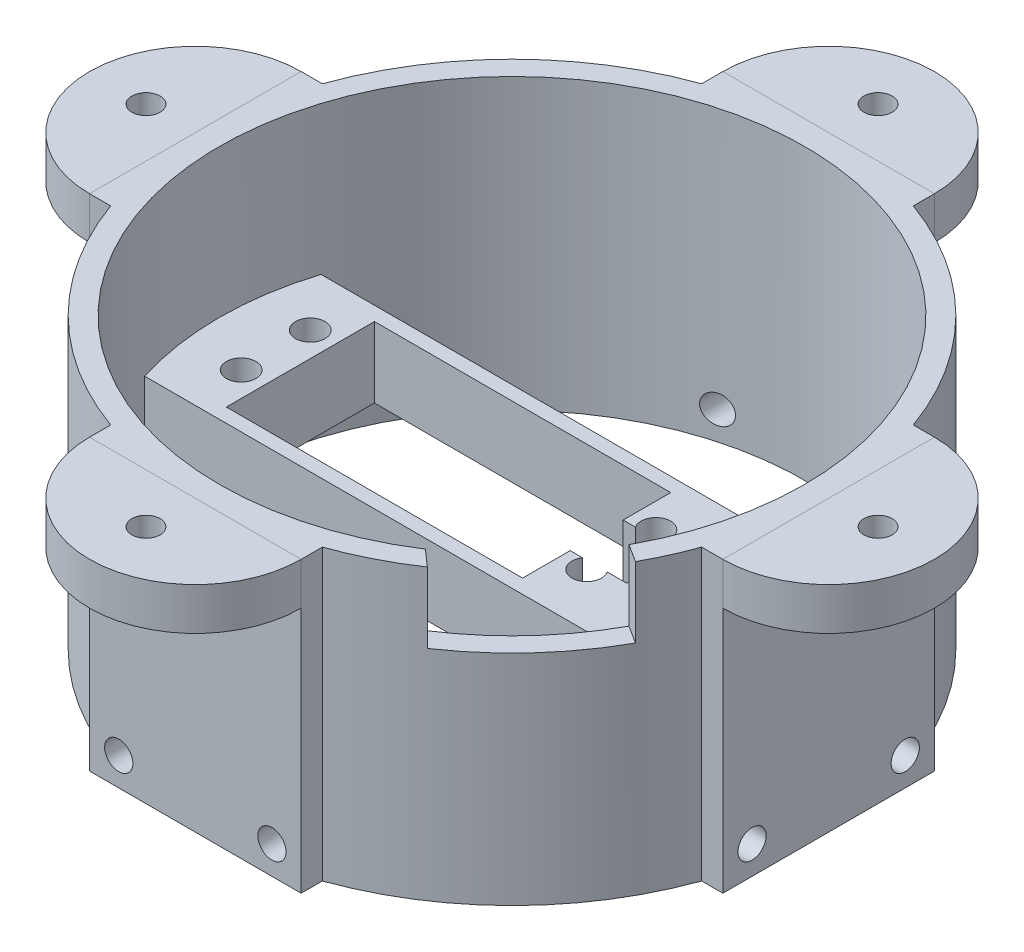
from build123d import *
from build123d.topology import SkipClean

# Parameters (mm, degrees)
SKETCH1_R             = 44.5
SKETCH1_R_2           = 41.5
BOSS_EXTRUDE1_DEPTH   = 41
SKETCH2_R             = 2.1
SKETCH2_W             = 42
SKETCH2_H             = 21
BOSS_EXTRUDE2_DEPTH   = 20
BOSS_EXTRUDE3_DEPTH   = 41
CIRPATTERN1_COUNT     = 4
SKETCH4_R             = 2
CUT_EXTRUDE1_DEPTH    = 7
CUT_EXTRUDE2_DEPTH    = 10
CIRPATTERN2_COUNT     = 4
SKETCH6_R             = 2
BOSS_EXTRUDE4_DEPTH   = 6
BOSS_EXTRUDE4_2_DEPTH = 6
BOSS_EXTRUDE4_3_DEPTH = 6
BOSS_EXTRUDE4_4_DEPTH = 6
SKETCH8_W             = 8
SKETCH8_H             = 7.5
CUT_EXTRUDE3_DEPTH    = 60
CUT_EXTRUDE4_START    = -10
CUT_EXTRUDE4_DEPTH    = 10


with BuildPart() as part:
    # Sketch1 → Boss-Extrude1 (new body)
    with BuildSketch(Plane(origin=(0, 0, 0), x_dir=(1, 0, 0), z_dir=(0, 1, 0))):
        Circle(SKETCH1_R)
        Circle(SKETCH1_R_2, mode=Mode.SUBTRACT)
    extrude(amount=BOSS_EXTRUDE1_DEPTH)

    # Sketch2 → Boss-Extrude2 (add)
    with BuildSketch(Plane(origin=(0, 0, 0), x_dir=(1, 0, 0), z_dir=(0, 1, 0))):
        with BuildLine():
            Line((-39.572717875, 12.5), (39.572717875, 12.5))
            ThreePointArc((39.572717875, 12.5), (41.658434963, 0), (39.572717875, -12.5))
            Line((39.572717875, -12.5), (-39.572717875, -12.5))
            ThreePointArc((-39.572717875, -12.5), (-41.658434963, 0), (-39.572717875, 12.5))
        make_face()
        with Locations((15.5, 4.9)):
            Circle(SKETCH2_R, mode=Mode.SUBTRACT)
        with Locations((15.5, -4.9)):
            Circle(SKETCH2_R, mode=Mode.SUBTRACT)
        with Locations((-33.5, 4.9)):
            Circle(SKETCH2_R, mode=Mode.SUBTRACT)
        with Locations((-33.5, -4.9)):
            Circle(SKETCH2_R, mode=Mode.SUBTRACT)
        with Locations((-9, 0)):
            Rectangle(SKETCH2_W, SKETCH2_H, mode=Mode.SUBTRACT)
    extrude(amount=BOSS_EXTRUDE2_DEPTH)

    # Sketch3 → Boss-Extrude3 (add)
    with BuildSketch(Plane(origin=(0, 0, 0), x_dir=(1, 0, 0), z_dir=(0, 1, 0))):
        with BuildLine():
            Line((0, 44.895703837), (-15, 44.895703837))
            Line((-15, 44.895703837), (-15, 41.895703837))
            ThreePointArc((-15, 41.895703837), (0, 44.5), (15, 41.895703837))
            Line((15, 41.895703837), (15, 44.895703837))
            Line((15, 44.895703837), (0, 44.895703837))
        make_face()
    boss_extrude3 = extrude(amount=BOSS_EXTRUDE3_DEPTH)

    # CirPattern1: Boss-Extrude3 ×4 about axis
    cirpattern1_axis = Axis((0, 41, 0), (0, -1, 0))
    for i in range(1, CIRPATTERN1_COUNT):
        add(boss_extrude3.rotate(cirpattern1_axis, i * 360 / CIRPATTERN1_COUNT))

    # Sketch4 → Cut-Extrude1 (cut)
    with BuildSketch(Plane.ZY.offset(44.895703837)):
        with Locations((10.859802344, 4)):
            Circle(SKETCH4_R)
        with Locations((-10.859802344, 4)):
            Circle(SKETCH4_R)
    cut_extrude1 = extrude(amount=-CUT_EXTRUDE1_DEPTH, mode=Mode.SUBTRACT)

    # Sketch5 → Cut-Extrude2 (cut)
    with SkipClean():  # the faces are left unmerged after this step: merging them gives an invalid solid
        with BuildSketch(Plane(origin=(0, 0, 0), x_dir=(1, 0, 0), z_dir=(0, 1, 0))):
            with BuildLine():
                Line((-39.572717875, 12.5), (39.572717875, 12.5))
                ThreePointArc((39.572717875, 12.5), (41.5, 0), (39.572717875, -12.5))
                Line((39.572717875, -12.5), (-39.572717875, -12.5))
                ThreePointArc((-39.572717875, -12.5), (-41.5, 0), (-39.572717875, 12.5))
            make_face()
        extrude(amount=CUT_EXTRUDE2_DEPTH, mode=Mode.SUBTRACT)

    # CirPattern2: Cut-Extrude1 ×4 about axis
    with SkipClean():  # the faces are left unmerged after this step: merging them gives an invalid solid
        cirpattern2_axis = Axis((0, 41, 0), (0, -1, 0))
        for i in range(1, CIRPATTERN2_COUNT):
            add(cut_extrude1.rotate(cirpattern2_axis, i * 360 / CIRPATTERN2_COUNT), mode=Mode.SUBTRACT)

    # Sketch8 → Cut-Extrude3 (cut)
    with SkipClean():  # the faces are left unmerged after this step: merging them gives an invalid solid
        with BuildSketch(Plane(origin=(0, 0, 0), x_dir=(1, 0, 0), z_dir=(0, 1, 0))):
            with Locations((16, 0)):
                Rectangle(SKETCH8_W, SKETCH8_H)
        extrude(amount=CUT_EXTRUDE3_DEPTH, mode=Mode.SUBTRACT)

    # Sketch9 → Cut-Extrude4 (cut)
    with SkipClean():  # the faces are left unmerged after this step: merging them gives an invalid solid
        with BuildSketch(Plane(origin=(0, 41, 0), x_dir=(1, 0, 0), z_dir=(0, 1, 0)).offset(CUT_EXTRUDE4_START)):
            with BuildLine():
                Line((36.441495651, -19.856167674), (38.976205671, -21.473364699))
                ThreePointArc((38.976205671, -21.473364699), (32.849182071, -30.019680832), (24.887814069, -36.889655879))
                Line((24.887814069, -36.889655879), (22.556482536, -34.834682367))
                ThreePointArc((22.556482536, -34.834682367), (30.434837492, -28.212952112), (36.441495651, -19.856167674))
            make_face()
        extrude(amount=CUT_EXTRUDE4_DEPTH, mode=Mode.SUBTRACT)


with BuildPart() as body_2:
    # Sketch6 → Boss-Extrude4 (new body)
    with BuildSketch(Plane(origin=(0, 41, 0), x_dir=(1, 0, 0), z_dir=(0, 1, 0))):
        with BuildLine():
            Line((-44.895703837, 15), (-44.895703837, -15))
            ThreePointArc((-44.895703837, -15), (-59.895703837, 0), (-44.895703837, 15))
        make_face()
        with Locations((-51.895703837, 0)):
            Circle(SKETCH6_R, mode=Mode.SUBTRACT)
    extrude(amount=-BOSS_EXTRUDE4_DEPTH)


with BuildPart() as body_3:
    # Sketch6 → Boss-Extrude4 2 (new body)
    with BuildSketch(Plane(origin=(0, 41, 0), x_dir=(1, 0, 0), z_dir=(0, 1, 0))):
        with BuildLine():
            Line((-15, 44.895703837), (15, 44.895703837))
            ThreePointArc((15, 44.895703837), (0, 59.895703837), (-15, 44.895703837))
        make_face()
        with Locations((0, 51.895703837)):
            Circle(SKETCH6_R, mode=Mode.SUBTRACT)
    extrude(amount=-BOSS_EXTRUDE4_2_DEPTH)


with BuildPart() as body_4:
    # Sketch6 → Boss-Extrude4 3 (new body)
    with BuildSketch(Plane(origin=(0, 41, 0), x_dir=(1, 0, 0), z_dir=(0, 1, 0))):
        with BuildLine():
            Line((44.895703837, 15), (44.895703837, -15))
            ThreePointArc((44.895703837, -15), (59.895703837, 0), (44.895703837, 15))
        make_face()
        with Locations((51.895703837, 0)):
            Circle(SKETCH6_R, mode=Mode.SUBTRACT)
    extrude(amount=-BOSS_EXTRUDE4_3_DEPTH)


with BuildPart() as body_5:
    # Sketch6 → Boss-Extrude4 4 (new body)
    with BuildSketch(Plane(origin=(0, 41, 0), x_dir=(1, 0, 0), z_dir=(0, 1, 0))):
        with BuildLine():
            Line((15, -44.895703837), (-15, -44.895703837))
            ThreePointArc((-15, -44.895703837), (0, -59.895703837), (15, -44.895703837))
        make_face()
        with Locations((0, -51.895703837)):
            Circle(SKETCH6_R, mode=Mode.SUBTRACT)
    extrude(amount=-BOSS_EXTRUDE4_4_DEPTH)


solid = Compound([part.part, body_2.part, body_3.part, body_4.part, body_5.part])
